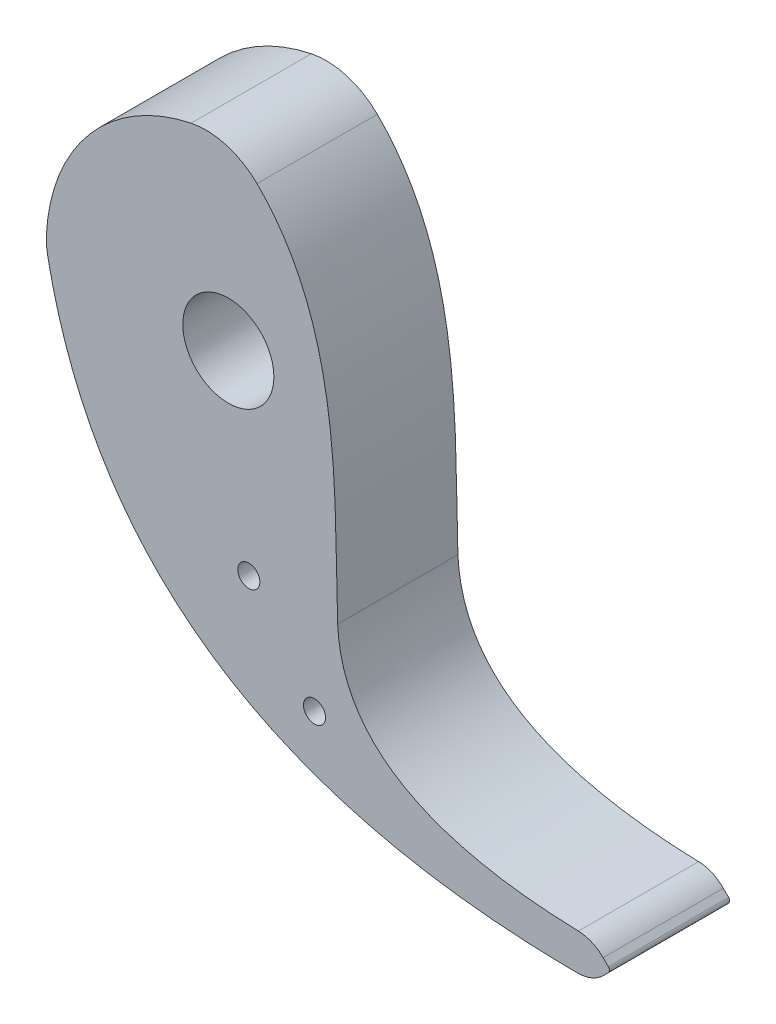
from build123d import *

# Parameters (mm, degrees)
CROQUIS1_R              = 10
SALIENTE_EXTRUIR1_DEPTH = 100
CORTAR_EXTRUIR4_DEPTH   = 15
CROQUIS3_W              = 244.799963401
CROQUIS3_H              = 159.784694376
CORTAR_EXTRUIR5_DEPTH   = 35
CAVIDAD1_START          = 35
CAVIDAD1_OUTLINE_R      = 3.03
CAVIDAD1_DEPTH          = 65
CROQUIS4_R              = 12.5
CORTAR_EXTRUIR6_DEPTH   = 65
CROQUIS5_W              = 213.058099932
CROQUIS5_H              = 195.665601979
CORTAR_EXTRUIR7_DEPTH   = 32


# Read off the part's stored shape, not the designer's step: Cavidad1
with BuildPart() as part:
    # Croquis1 → Saliente-Extruir1 (new body)
    with BuildSketch(Plane.XY):
        with BuildLine():
            Line((102.84709295, -92.84709295), (104.292893219, -94.292893219))
            ThreePointArc((104.292893219, -94.292893219), (104.585786438, -95), (104.292893219, -95.707106781))
            Line((104.292893219, -95.707106781), (102.924090823, -97.075909177))
            ThreePointArc((102.924090823, -97.075909177), (99.655924863, -99.253513567), (95.801242309, -100.004707302))
            add(Edge.make_bspline(
                [(-49.58600728, -2.205776949), (-47.044709507, -15.23286343), (-27.045253615, -73.563310407), (28.636670051, -99.656919769), (95.801242309, -100.004707302)],
                knots=[0.011039812, 0.011039812, 0.011039812, 0.011039812, 0.207725041, 0.983937689, 0.983937689, 0.983937689, 0.983937689], degree=3))
            ThreePointArc((-49.58600728, -2.205776949), (-49.90808847, 0.239585929), (-49.92672205, 2.705998037))
            ThreePointArc((-49.92672205, 2.705998037), (-37.935964584, 32.570885635), (-10.229250857, 48.942439936))
            ThreePointArc((-10.229250857, 48.942439936), (-0.503550938, 48.555514737), (7.88775097, 43.623476385))
            add(Edge.make_bspline(
                [(30, -50), (29.065577858, -23.91659264), (31.451883129, 15.353668912), (10.5535399, 41.001196903), (7.88775097, 43.623476385)],
                knots=[0, 0, 0, 0, 0.805376889, 0.908560603, 0.908560603, 0.908560603, 0.908560603], degree=3))
            add(Edge.make_bspline(
                [(96.061432126, -89.922234449), (74.639632489, -89.310592156), (42.207594165, -82.045244121), (30.598677739, -62.69576919), (30, -50)],
                knots=[0.027764728, 0.027764728, 0.027764728, 0.027764728, 0.487449894, 0.947135059, 0.947135059, 0.947135059, 0.947135059], degree=3))
            ThreePointArc((96.061432126, -89.922234449), (99.734323975, -90.734922209), (102.84709295, -92.84709295))
        make_face()
        Circle(CROQUIS1_R, mode=Mode.SUBTRACT)
    extrude(amount=SALIENTE_EXTRUIR1_DEPTH)

    # Croquis2 → Cortar-Extruir4 (cut)
    with BuildSketch(Plane(origin=(0, 0, 0), x_dir=(-1, 0, 0), z_dir=(0, 0, -1))):
        with BuildLine():
            ThreePointArc((1.102623365, 39.984799883), (1.653330869, 39.965816607), (2.203724614, 39.939248839))
            ThreePointArc((2.203724614, 39.939248839), (3.208029629, 37.678468026), (3.853201686, 35.290265468))
            ThreePointArc((3.853201686, 35.290265468), (4.391380959, 35.227344113), (4.928537187, 35.156215968))
            ThreePointArc((4.928537187, 35.156215968), (6.140272041, 37.312939662), (7.668866774, 39.257973488))
            ThreePointArc((7.668866774, 39.257973488), (8.208938801, 39.148605643), (8.747452981, 39.031808392))
            ThreePointArc((8.747452981, 39.031808392), (9.365948293, 36.63655851), (9.609235823, 34.174736091))
            ThreePointArc((9.609235823, 34.174736091), (10.129718517, 34.024091505), (10.647841327, 33.865520446))
            ThreePointArc((10.647841327, 33.865520446), (12.198034749, 35.793384238), (14.025923488, 37.460291914))
            ThreePointArc((14.025923488, 37.460291914), (14.540628281, 37.263522769), (15.052573634, 37.05968196))
            ThreePointArc((15.052573634, 37.05968196), (15.268388303, 34.595299183), (15.103155055, 32.127009001))
            ThreePointArc((15.103155055, 32.127009001), (15.591743761, 31.892750375), (16.076700112, 31.651061807))
            ThreePointArc((16.076700112, 31.651061807), (17.923066867, 33.297478598), (20.000389573, 34.640791229))
            ThreePointArc((20.000389573, 34.640791229), (20.475687326, 34.361988134), (20.947099317, 34.076664012))
            ThreePointArc((20.947099317, 34.076664012), (20.754346482, 31.610370276), (20.18509959, 29.202940855))
            ThreePointArc((20.18509959, 29.202940855), (20.628466879, 28.891458153), (21.067028427, 28.57324471))
            ThreePointArc((21.067028427, 28.57324471), (23.159204443, 29.893304542), (25.429297167, 30.87638006))
            ThreePointArc((25.429297167, 30.87638006), (25.852222997, 30.523148037), (26.270242736, 30.164123501))
            ThreePointArc((26.270242736, 30.164123501), (25.674180192, 27.763192871), (24.716447225, 25.482292608))
            ThreePointArc((24.716447225, 25.482292608), (25.102499195, 25.102082267), (25.482703124, 24.716023982))
            ThreePointArc((25.482703124, 24.716023982), (27.763619294, 25.673719065), (30.164559823, 26.269741732))
            ThreePointArc((30.164559823, 26.269741732), (30.523577417, 25.85171603), (30.876802415, 25.428784332))
            ThreePointArc((30.876802415, 25.428784332), (29.893689193, 23.158707937), (28.573594612, 21.066553846))
            ThreePointArc((28.573594612, 21.066553846), (28.891800771, 20.627987013), (29.203276108, 20.18461455))
            ThreePointArc((29.203276108, 20.18461455), (31.610714984, 20.753821458), (34.077011921, 20.94653333))
            ThreePointArc((34.077011921, 20.94653333), (34.362328213, 20.4751166), (34.641123413, 19.999814215))
            ThreePointArc((34.641123413, 19.999814215), (33.297776281, 17.922513822), (31.651328823, 16.076174412))
            ThreePointArc((31.651328823, 16.076174412), (31.893009337, 15.591214047), (32.127259848, 15.102621451))
            ThreePointArc((32.127259848, 15.102621451), (34.595552773, 15.267813702), (37.059931966, 15.051958102))
            ThreePointArc((37.059931966, 15.051958102), (37.263764272, 14.540009363), (37.460524868, 14.025301302))
            ThreePointArc((37.460524868, 14.025301302), (35.793586832, 12.197440249), (33.865697293, 10.647278847))
            ThreePointArc((33.865697293, 10.647278847), (34.024259747, 10.129153404), (34.174895688, 9.608668207))
            ThreePointArc((34.174895688, 9.608668207), (36.636714066, 9.365339789), (39.031953674, 8.746804694))
            ThreePointArc((39.031953674, 8.746804694), (39.148741981, 8.208288574), (39.258100856, 7.668214731))
            ThreePointArc((39.258100856, 7.668214731), (37.313041641, 6.139652303), (35.156297822, 4.927953271))
            ThreePointArc((35.156297822, 4.927953271), (35.227417046, 4.390795861), (35.290329461, 3.852615543))
            ThreePointArc((35.290329461, 3.852615543), (37.678521304, 3.20740382), (39.939285436, 2.203061256))
            ThreePointArc((39.939285436, 2.203061256), (39.965844062, 1.65266707), (39.984818192, 1.101959251))
            ThreePointArc((39.984818192, 1.101959251), (37.814693942, -0.085609353), (35.487926192, -0.925794025))
            ThreePointArc((35.487926192, -0.925794025), (35.469662238, -1.467331147), (35.443135042, -2.00852643))
            ThreePointArc((35.443135042, -2.00852643), (37.692556701, -3.038021764), (39.757177604, -4.400775951))
            ThreePointArc((39.757177604, -4.400775951), (39.692782099, -4.948034883), (39.620853919, -5.494354805))
            ThreePointArc((39.620853919, -5.494354805), (37.284859968, -6.308535809), (34.851536446, -6.754288072))
            ThreePointArc((34.851536446, -6.754288072), (34.744387508, -7.285433186), (34.629144292, -7.814881038))
            ThreePointArc((34.629144292, -7.814881038), (36.678437409, -9.200578033), (38.490597607, -10.884571461))
            ThreePointArc((38.490597607, -10.884571461), (38.337004513, -11.413767343), (38.176136036, -11.940797184))
            ThreePointArc((38.176136036, -11.940797184), (35.737992209, -12.359381853), (33.264487636, -12.398542748))
            ThreePointArc((33.264487636, -12.398542748), (33.071376458, -12.904807599), (32.870560757, -13.408066063))
            ThreePointArc((32.870560757, -13.408066063), (34.663825958, -15.112166519), (36.174094444, -17.071464236))
            ThreePointArc((36.174094444, -17.071464236), (35.935493381, -17.568161984), (35.690072679, -18.061525743))
            ThreePointArc((35.690072679, -18.061525743), (33.216285184, -18.073096179), (30.770070318, -17.704597499))
            ThreePointArc((30.770070318, -17.704597499), (30.496264469, -18.172172502), (30.215354012, -18.635513998))
            ThreePointArc((30.215354012, -18.635513998), (31.703675696, -20.611534496), (32.870856284, -22.792691969))
            ThreePointArc((32.870856284, -22.792691969), (32.553755666, -23.243342962), (32.230477177, -23.689582963))
            ThreePointArc((32.230477177, -23.689582963), (29.788524487, -23.293823554), (27.436325694, -22.527716982))
            ThreePointArc((27.436325694, -22.527716982), (27.089293883, -22.94384791), (26.735951175, -23.35463369))
            ThreePointArc((26.735951175, -23.35463369), (27.878731807, -25.548673542), (28.670986852, -27.89219448))
            ThreePointArc((28.670986852, -27.89219448), (28.284036357, -28.284506136), (27.891718275, -28.671450114))
            ThreePointArc((27.891718275, -28.671450114), (25.548210496, -27.879156145), (23.354189625, -26.736339072))
            ThreePointArc((23.354189625, -26.736339072), (22.943397976, -27.089674957), (22.527261285, -27.436699856))
            ThreePointArc((22.527261285, -27.436699856), (23.293328789, -29.788911374), (23.689047639, -32.230870636))
            ThreePointArc((23.689047639, -32.230870636), (23.242802268, -32.554141714), (22.792146008, -32.871234847))
            ThreePointArc((22.792146008, -32.871234847), (20.611007921, -31.704018032), (18.635012143, -30.215663528))
            ThreePointArc((18.635012143, -30.215663528), (18.171665982, -30.496566289), (17.704086432, -30.770364373))
            ThreePointArc((17.704086432, -30.770364373), (18.072544482, -33.216585358), (18.060932958, -35.690372661))
            ThreePointArc((18.060932958, -35.690372661), (17.567565123, -35.935785168), (17.070863412, -36.174377982))
            ThreePointArc((17.070863412, -36.174377982), (15.111590779, -34.664076954), (13.407520108, -32.870783449))
            ThreePointArc((13.407520108, -32.870783449), (12.90425831, -33.071590791), (12.397990251, -33.264693561))
            ThreePointArc((12.397990251, -33.264693561), (12.358788274, -35.738197483), (11.940163108, -38.176334357))
            ThreePointArc((11.940163108, -38.176334357), (11.413130596, -38.337194081), (10.883932163, -38.490778385))
            ThreePointArc((10.883932163, -38.490778385), (9.199968834, -36.678590218), (7.814305875, -34.629274085))
            ThreePointArc((7.814305875, -34.629274085), (7.28485611, -34.744508508), (6.753709216, -34.851648624))
            ThreePointArc((6.753709216, -34.851648624), (6.307916538, -37.284964743), (5.493696735, -39.62094517))
            ThreePointArc((5.493696735, -39.62094517), (4.947375618, -39.692864277), (4.400115616, -39.757250692))
            ThreePointArc((4.400115616, -39.757250692), (3.037395721, -37.692607155), (2.007937749, -35.443168397))
            ThreePointArc((2.007937749, -35.443168397), (1.466742025, -35.469686605), (0.9252046, -35.487941564))
            ThreePointArc((0.9252046, -35.487941564), (0.084981283, -37.814695359), (-1.102623365, -39.984799883))
            ThreePointArc((-1.102623365, -39.984799883), (-1.653330869, -39.965816607), (-2.203724614, -39.939248839))
            ThreePointArc((-2.203724614, -39.939248839), (-3.208029629, -37.678468026), (-3.853201686, -35.290265468))
            ThreePointArc((-3.853201686, -35.290265468), (-4.391380959, -35.227344113), (-4.928537187, -35.156215968))
            ThreePointArc((-4.928537187, -35.156215968), (-6.140272041, -37.312939662), (-7.668866774, -39.257973488))
            ThreePointArc((-7.668866774, -39.257973488), (-8.208938801, -39.148605643), (-8.747452981, -39.031808392))
            ThreePointArc((-8.747452981, -39.031808392), (-9.365948293, -36.63655851), (-9.609235823, -34.174736091))
            ThreePointArc((-9.609235823, -34.174736091), (-10.129718517, -34.024091505), (-10.647841327, -33.865520446))
            ThreePointArc((-10.647841327, -33.865520446), (-12.198034749, -35.793384238), (-14.025923488, -37.460291914))
            ThreePointArc((-14.025923488, -37.460291914), (-14.540628281, -37.263522769), (-15.052573634, -37.05968196))
            ThreePointArc((-15.052573634, -37.05968196), (-15.268388303, -34.595299183), (-15.103155055, -32.127009001))
            ThreePointArc((-15.103155055, -32.127009001), (-15.591743761, -31.892750375), (-16.076700112, -31.651061807))
            ThreePointArc((-16.076700112, -31.651061807), (-17.923066867, -33.297478598), (-20.000389573, -34.640791229))
            ThreePointArc((-20.000389573, -34.640791229), (-20.475687326, -34.361988134), (-20.947099317, -34.076664012))
            ThreePointArc((-20.947099317, -34.076664012), (-20.754346482, -31.610370276), (-20.18509959, -29.202940855))
            ThreePointArc((-20.18509959, -29.202940855), (-20.628466879, -28.891458153), (-21.067028427, -28.57324471))
            ThreePointArc((-21.067028427, -28.57324471), (-23.159204443, -29.893304542), (-25.429297167, -30.87638006))
            ThreePointArc((-25.429297167, -30.87638006), (-25.852222997, -30.523148037), (-26.270242736, -30.164123501))
            ThreePointArc((-26.270242736, -30.164123501), (-25.674180192, -27.763192871), (-24.716447225, -25.482292608))
            ThreePointArc((-24.716447225, -25.482292608), (-25.102499195, -25.102082267), (-25.482703124, -24.716023982))
            ThreePointArc((-25.482703124, -24.716023982), (-27.421409872, -25.555856409), (-29.453588357, -26.133916065))
            add(Edge.make_bspline(
                [(-30, -50), (-29.734872846, -42.599255467), (-29.715262914, -34.495945215), (-29.453588357, -26.133916065)],
                knots=[0, 0, 0, 0, 0.228512653, 0.228512653, 0.228512653, 0.228512653], degree=3))
            add(Edge.make_bspline(
                [(-96.061432126, -89.922234449), (-74.639632489, -89.310592156), (-42.207594165, -82.045244121), (-30.598677739, -62.69576919), (-30, -50)],
                knots=[0.027764728, 0.027764728, 0.027764728, 0.027764728, 0.487449894, 0.947135059, 0.947135059, 0.947135059, 0.947135059], degree=3))
            ThreePointArc((-96.061432126, -89.922234449), (-99.734323975, -90.734922209), (-102.84709295, -92.84709295))
            Line((-102.84709295, -92.84709295), (-104.292893219, -94.292893219))
            ThreePointArc((-104.292893219, -94.292893219), (-104.585786438, -95), (-104.292893219, -95.707106781))
            Line((-104.292893219, -95.707106781), (-102.924090823, -97.075909177))
            ThreePointArc((-102.924090823, -97.075909177), (-99.655924863, -99.253513567), (-95.801242309, -100.004707302))
            add(Edge.make_bspline(
                [(49.58600728, -2.205776949), (47.044709507, -15.23286343), (27.045253615, -73.563310407), (-28.636670051, -99.656919769), (-95.801242309, -100.004707302)],
                knots=[0.011039812, 0.011039812, 0.011039812, 0.011039812, 0.207725041, 0.983937689, 0.983937689, 0.983937689, 0.983937689], degree=3))
            ThreePointArc((49.58600728, -2.205776949), (49.90808847, 0.239585929), (49.92672205, 2.705998037))
            ThreePointArc((49.92672205, 2.705998037), (37.935964584, 32.570885635), (10.229250857, 48.942439936))
            ThreePointArc((10.229250857, 48.942439936), (0.503550938, 48.555514737), (-7.88775097, 43.623476385))
            add(Edge.make_bspline(
                [(-15.182020199, 34.727214957), (-15.121605489, 34.818294405), (-12.99668952, 38.002837294), (-10.5535399, 41.001196903), (-7.88775097, 43.623476385)],
                knots=[0.802344073, 0.802344073, 0.802344073, 0.802344073, 0.805376889, 0.908560603, 0.908560603, 0.908560603, 0.908560603], degree=3))
            ThreePointArc((-15.182020199, 34.727214957), (-14.257602386, 33.834526615), (-13.407520108, 32.870783449))
            ThreePointArc((-13.407520108, 32.870783449), (-12.90425831, 33.071590791), (-12.397990251, 33.264693561))
            ThreePointArc((-12.397990251, 33.264693561), (-12.358788274, 35.738197483), (-11.940163108, 38.176334357))
            ThreePointArc((-11.940163108, 38.176334357), (-11.413130596, 38.337194081), (-10.883932163, 38.490778385))
            ThreePointArc((-10.883932163, 38.490778385), (-9.199968834, 36.678590218), (-7.814305875, 34.629274085))
            ThreePointArc((-7.814305875, 34.629274085), (-7.28485611, 34.744508508), (-6.753709216, 34.851648624))
            ThreePointArc((-6.753709216, 34.851648624), (-6.307916538, 37.284964743), (-5.493696735, 39.62094517))
            ThreePointArc((-5.493696735, 39.62094517), (-4.947375618, 39.692864277), (-4.400115616, 39.757250692))
            ThreePointArc((-4.400115616, 39.757250692), (-3.037395721, 37.692607155), (-2.007937749, 35.443168397))
            ThreePointArc((-2.007937749, 35.443168397), (-1.466742025, 35.469686605), (-0.9252046, 35.487941564))
            ThreePointArc((-0.9252046, 35.487941564), (-0.084981283, 37.814695359), (1.102623365, 39.984799883))
        make_face()
    extrude(amount=-CORTAR_EXTRUIR4_DEPTH, mode=Mode.SUBTRACT)

    # Croquis3 → Cortar-Extruir5 (cut)
    with BuildSketch(Plane(origin=(0, 0, 0), x_dir=(-1, 0, 0), z_dir=(0, 0, -1))):
        with Locations((-26.261343778, -29.231181028)):
            Rectangle(CROQUIS3_W, CROQUIS3_H)
    extrude(amount=-CORTAR_EXTRUIR5_DEPTH, mode=Mode.SUBTRACT)

    # Cavidad1 outline → Cavidad1 (cut)
    with BuildSketch(Plane.XY.offset(CAVIDAD1_START)):
        with Locations((23.651318082, -73.91381178)):
            Circle(CAVIDAD1_OUTLINE_R)
        with Locations((5.62196341, -50.701498074)):
            Circle(CAVIDAD1_OUTLINE_R)
    extrude(amount=CAVIDAD1_DEPTH, mode=Mode.SUBTRACT)

    # Croquis4 → Cortar-Extruir6 (cut)
    with BuildSketch(Plane.XY.offset(100)):
        Circle(CROQUIS4_R)
    extrude(amount=-CORTAR_EXTRUIR6_DEPTH, mode=Mode.SUBTRACT)

    # Croquis5 → Cortar-Extruir7 (cut)
    with BuildSketch(Plane(origin=(7.88775097, 43.623476385, 35), x_dir=(-1, 0, 0), z_dir=(0, 0, -1))):
        with Locations((-26.613557115, -76.115750781)):
            Rectangle(CROQUIS5_W, CROQUIS5_H)
    extrude(amount=-CORTAR_EXTRUIR7_DEPTH, mode=Mode.SUBTRACT)


solid = part.part
